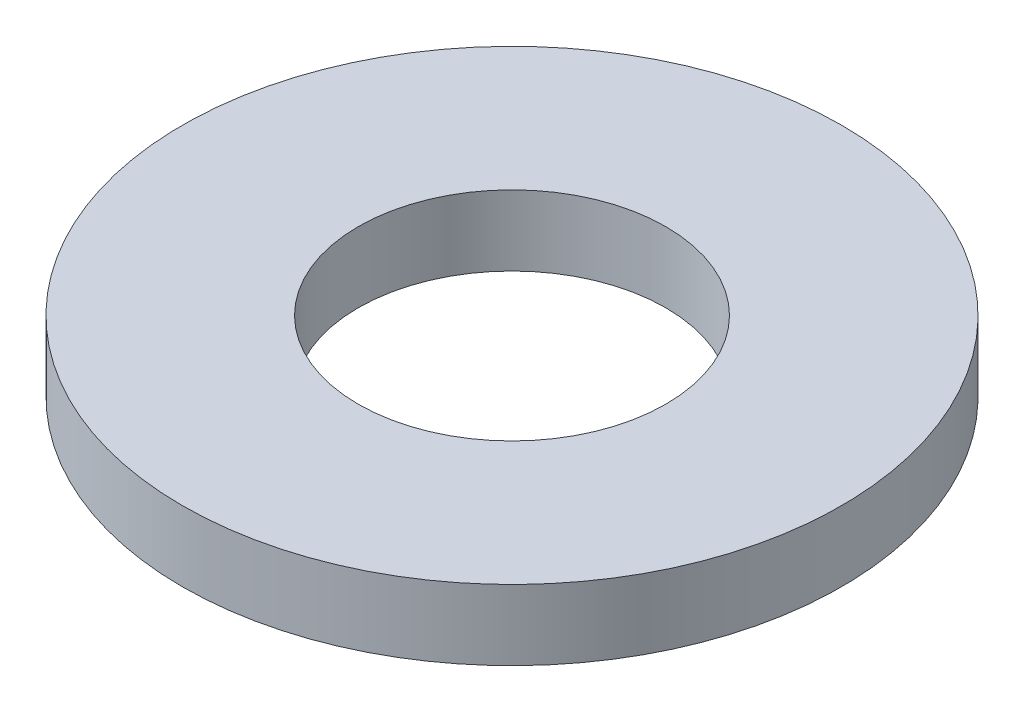
from build123d import *

# Parameters (mm, degrees)
SKETCH1_R           = 37.5
BOSS_EXTRUDE1_DEPTH = 8
SKETCH2_R           = 17.5
CUT_EXTRUDE1_DEPTH  = 54.633012222


with BuildPart() as part:
    # Sketch1 → Boss-Extrude1 (new body)
    with BuildSketch(Plane(origin=(0, 0, 0), x_dir=(1, 0, 0), z_dir=(0, 1, 0))):
        Circle(SKETCH1_R)
    extrude(amount=BOSS_EXTRUDE1_DEPTH)

    # Sketch2 → Cut-Extrude1 (cut, through all)
    with BuildSketch(Plane(origin=(0, 0, 0), x_dir=(1, 0, 0), z_dir=(0, 1, 0))):
        Circle(SKETCH2_R)
    extrude(amount=CUT_EXTRUDE1_DEPTH, mode=Mode.SUBTRACT)


solid = part.part
